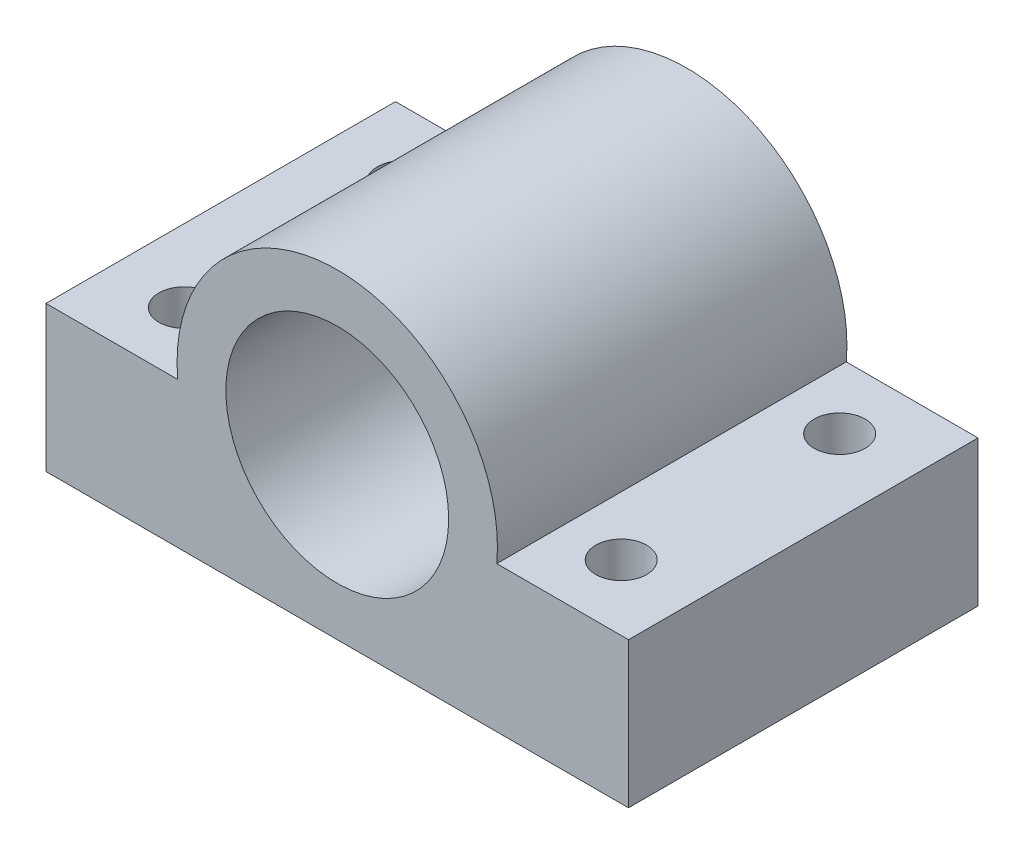
from build123d import *

# Parameters (mm, degrees)
ESBO_O1_R                = 7.65
RESSALTO_EXTRUS_O1_DEPTH = 24
ESBO_O2_R                = 1.75
CORTE_EXTRUS_O1_DEPTH    = 20


with BuildPart() as part:
    # Esboço1 → Ressalto-extrusão1 (new body)
    with BuildSketch(Plane.XY):
        with BuildLine():
            Line((-10.95445115, -1), (-20, -1))
            Line((-20, -1), (-20, -11))
            Line((-20, -11), (0, -11))
            Line((0, -11), (20, -11))
            Line((20, -11), (20, -1))
            Line((20, -1), (10.95445115, -1))
            ThreePointArc((10.95445115, -1), (0, 11), (-10.95445115, -1))
        make_face()
        Circle(ESBO_O1_R, mode=Mode.SUBTRACT)
    extrude(amount=RESSALTO_EXTRUS_O1_DEPTH)

    # Esboço2 → Corte-extrusão1 (cut)
    with BuildSketch(Plane.XZ.offset(11)):
        with Locations((15, 19.5)):
            Circle(ESBO_O2_R)
        with Locations((15, 4.5)):
            Circle(ESBO_O2_R)
        with Locations((-15, 4.5)):
            Circle(ESBO_O2_R)
        with Locations((-15, 19.5)):
            Circle(ESBO_O2_R)
    extrude(amount=-CORTE_EXTRUS_O1_DEPTH, mode=Mode.SUBTRACT)


solid = part.part
